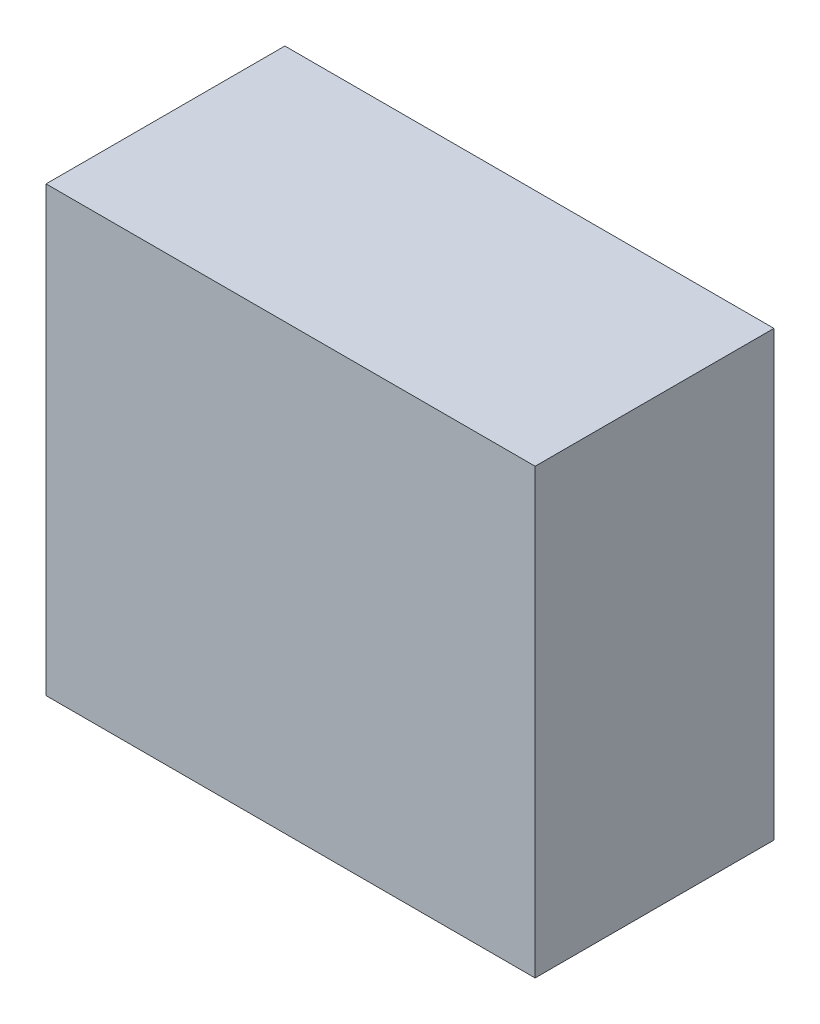
from build123d import *

# Parameters (mm, degrees)
SKETCH_1_W      = 25.6
SKETCH_1_H      = 23.2
EXTRUDE_1_DEPTH = 6.25


with BuildPart() as part:
    # Эскиз1 → Бобышка-Вытянуть1 (new, symmetric)
    with BuildSketch(Plane.XY):
        Rectangle(SKETCH_1_W, SKETCH_1_H)
    extrude(amount=EXTRUDE_1_DEPTH, both=True)


solid = part.part
